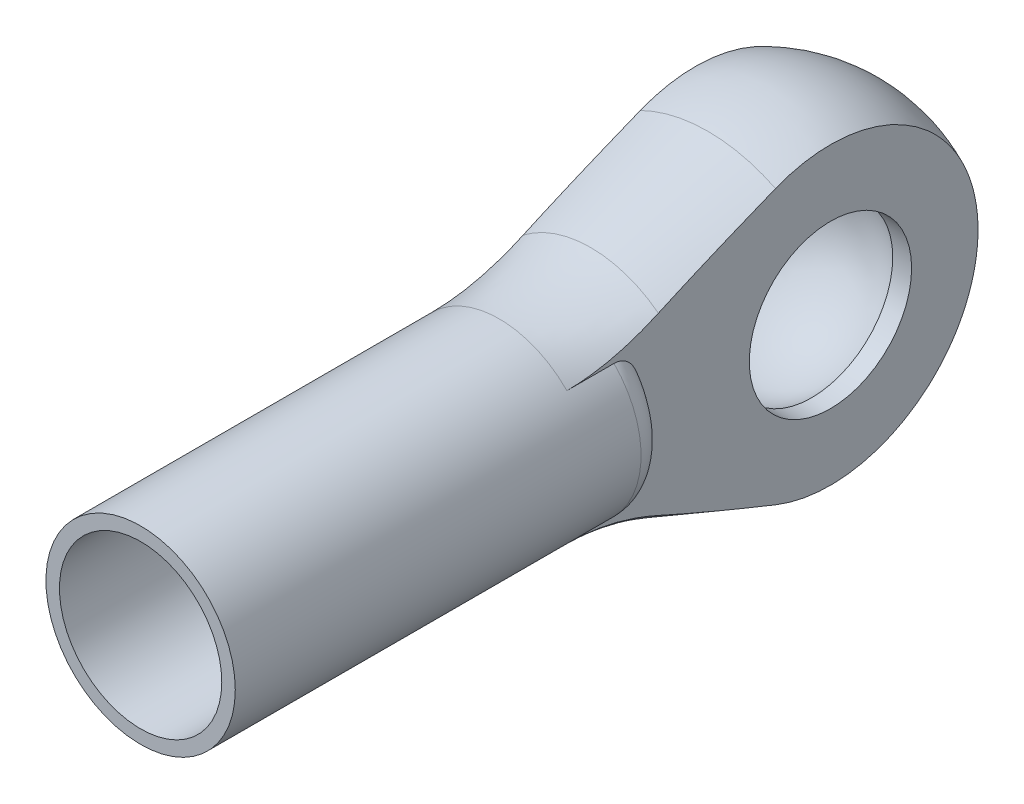
from build123d import *

# Parameters (mm, degrees)
SKETCH2_W           = 3.765548925
SKETCH2_H           = 14.748929387
SKETCH2_W_2         = 4.619974481
CUT_EXTRUDE1_DEPTH  = 17.5
CHAMFER1_SIZE       = 0.353571801
CHAMFER1_SIZE_2     = 0.5
SKETCH3_R           = 3
CUT_EXTRUDE2_DEPTH  = 35
SKETCH4_R           = 3.5
SKETCH4_R_2         = 3
BOSS_EXTRUDE1_DEPTH = 15
BOSS_EXTRUDE2_DEPTH = 1
BOSS_EXTRUDE3_START = -1
SKETCH4_2_R         = 3.5
SKETCH4_2_R_2       = 3
BOSS_EXTRUDE3_DEPTH = 1
BOSS_EXTRUDE4_START = -1
BOSS_EXTRUDE4_DEPTH = 1
FILLET1_R           = 1
FILLET2_R           = 10


# Some blends are built 0.0001 mm under size
with BuildPart() as part:
    # Sketch1 → Revolve1 (revolve)
    with BuildSketch(Plane(origin=(0, 0, 0), x_dir=(0, 0, -1), z_dir=(1, 0, 0))):
        with BuildLine():
            Line((0, 3.5), (0, 0))
            Line((0, 0), (4.5, 0))
            ThreePointArc((4.5, 0), (8, 3.5), (11.5, 0))
            Line((11.5, 0), (14, 0))
            ThreePointArc((14, 0), (11.451186904, 4.908086078), (5.97023035, 5.6462408))
            Line((5.97023035, 5.6462408), (0, 3.5))
        make_face()
    revolve(axis=Axis((0, 0, 0), (0, 0, -1)))

    # Sketch2 → Cut-Extrude1 (cut, symmetric)
    with BuildSketch(Plane(origin=(0, 0, 0), x_dir=(1, 0, 0), z_dir=(0, 1, 0))):
        with Locations((-4.382774463, 6.625535306)):
            Rectangle(SKETCH2_W, SKETCH2_H)
        with Locations((4.80998724, 6.625535306)):
            Rectangle(SKETCH2_W_2, SKETCH2_H)
    extrude(amount=CUT_EXTRUDE1_DEPTH, both=True, mode=Mode.SUBTRACT)

    # Chamfer1
    # the kernel refuses this chamfer: 0.5, 0.353571801 mm, written as the material it takes off along each edge
    with BuildSketch(Plane(origin=(-2.5, 0, -8), x_dir=(0, 0, 1), z_dir=(0, 1, 0))) as chamfer1_piece_1:
        with BuildLine():
            Line((2.807242504, 0.409691525), (2.449489743 + CHAMFER1_SIZE * 0.999999998636, 0))
            Line((2.449489743 + CHAMFER1_SIZE * 0.999999998636, 0), (2.449489743, 0))
            ThreePointArc((2.449489743, 0), (2.641353047, 0.203643303), (2.807242504, 0.409691525))
        make_face()
    revolve(axis=Axis((-2.5, 0, -8), (1, 0, 0)), mode=Mode.SUBTRACT)
    with BuildSketch(Plane(origin=(2.5, 0, -8), x_dir=(0, 0, -1), z_dir=(0, 1, 0))) as chamfer1_piece_2:
        with BuildLine():
            Line((2.449489743 + CHAMFER1_SIZE_2, 0), (2.689392867, 0.260096876))
            ThreePointArc((2.689392867, 0.260096876), (2.573005025, 0.127312675), (2.449489743, 0))
            Line((2.449489743, 0), (2.449489743 + CHAMFER1_SIZE_2, 0))
        make_face()
    revolve(axis=Axis((2.5, 0, -8), (-1, 0, 0)), mode=Mode.SUBTRACT)

    # Sketch3 → Cut-Extrude2 (cut)
    with BuildSketch(Plane(origin=(2.5, 0, 0), x_dir=(0, 0, -1), z_dir=(1, 0, 0))):
        with Locations((8, 0)):
            Circle(SKETCH3_R)
    extrude(amount=-CUT_EXTRUDE2_DEPTH, mode=Mode.SUBTRACT)

    # Sketch4 → Boss-Extrude1 (add)
    with BuildSketch(Plane.XY):
        with Locations(Location((0, 0, 0), (0, 0, 135.584691403))):
            Circle(SKETCH4_R)
        with Locations(Location((0, 0, 0), (0, 0, 213.557309762))):
            Circle(SKETCH4_R_2, mode=Mode.SUBTRACT)
    extrude(amount=BOSS_EXTRUDE1_DEPTH)

    # Sketch5 → Boss-Extrude2 (add)
    with BuildSketch(Plane.XY):
        with BuildLine():
            Line((2.5, 1.658312395), (2.5, -1.658312395))
            ThreePointArc((2.5, -1.658312395), (2.872281323, -0.866025404), (3, 0))
            ThreePointArc((3, 0), (2.872281323, 0.866025404), (2.5, 1.658312395))
        make_face()
        with BuildLine():
            ThreePointArc((-2.5, -1.658312395), (0, -3), (2.5, -1.658312395))
            Line((2.5, -1.658312395), (2.5, 1.658312395))
            ThreePointArc((2.5, 1.658312395), (0, 3), (-2.5, 1.658312395))
            Line((-2.5, 1.658312395), (-2.5, -1.658312395))
        make_face()
        with BuildLine():
            ThreePointArc((-2.5, 1.658312395), (-3, 0), (-2.5, -1.658312395))
            Line((-2.5, -1.658312395), (-2.5, 1.658312395))
        make_face()
    extrude(amount=BOSS_EXTRUDE2_DEPTH)

    # Sketch4<2> → Boss-Extrude3 (add)
    with BuildSketch(Plane.XY.offset(BOSS_EXTRUDE3_START)):
        with Locations(Location((0, 0, 0), (0, 0, 135.584691403))):
            Circle(SKETCH4_2_R)
        Circle(SKETCH4_2_R_2, mode=Mode.SUBTRACT)
    extrude(amount=BOSS_EXTRUDE3_DEPTH)

    # Sketch5<4> → Boss-Extrude4 (add)
    with BuildSketch(Plane.XY.offset(BOSS_EXTRUDE4_START)):
        with BuildLine():
            Line((2.5, 1.658312395), (2.5, -1.658312395))
            ThreePointArc((2.5, -1.658312395), (2.872281323, -0.866025404), (3, 0))
            ThreePointArc((3, 0), (2.872281323, 0.866025404), (2.5, 1.658312395))
        make_face()
        with BuildLine():
            ThreePointArc((-2.5, 1.658312395), (-3, 0), (-2.5, -1.658312395))
            Line((-2.5, -1.658312395), (-2.5, 1.658312395))
        make_face()
    extrude(amount=BOSS_EXTRUDE4_DEPTH)

    # Fillet1
    fillet1_edges = [part.edges().sort_by_distance(p)[0] for p in [
        (-3.5, 0, -1),
        (3.5, 0, -1),
    ]]
    fillet(fillet1_edges, radius=FILLET1_R - 0.0001)  # a hair under: the kernel refuses the full size

    # Fillet2
    # the kernel refuses this fillet: 10 mm, written as the material it adds along each edge
    with BuildSketch(Plane(origin=(0, 0, 0), x_dir=(-0.8914706902273792, -0.453078369010837, 0), z_dir=(0.453078369010837, -0.8914706902273792, 0))) as fillet2_piece_1_section:
        with BuildLine():
            CenterArc((3.5 + FILLET2_R, -FILLET2_R * 0.174285392608), FILLET2_R, 160.226973292, 19.773026708)
            Line((3.5 + FILLET2_R * 0.0589598667305, FILLET2_R * 0.164009549087), (3.5, 0))
            Line((3.5, 0), (3.5, -FILLET2_R * 0.174285392608))
        make_face()
    fillet2_piece_1 = revolve(axis=Axis((0, 0, 0), (0, 0, -1)), revolution_arc=233.882722234, mode=Mode.PRIVATE)
    fillet2_piece_1 = split(fillet2_piece_1, bisect_by=Plane(origin=(2.5, 0, 0), z_dir=(-1, 0, 0)), keep=Keep.TOP, mode=Mode.PRIVATE)
    fillet2_piece_1 = split(fillet2_piece_1, bisect_by=Plane(origin=(-2.5, 0, 0), z_dir=(1, 0, 0)), keep=Keep.TOP, mode=Mode.PRIVATE)
    add(fillet2_piece_1)
    with BuildSketch(Plane(origin=(0, 0, 0), x_dir=(0.8914706902273793, 0.4530783690108364, 0), z_dir=(-0.4530783690108364, 0.8914706902273793, 0))) as fillet2_piece_2_section:
        with BuildLine():
            CenterArc((3.5 + FILLET2_R, -FILLET2_R * 0.174285392608), FILLET2_R, 160.226973292, 19.773026708)
            Line((3.5 + FILLET2_R * 0.0589598667305, FILLET2_R * 0.164009549087), (3.5, 0))
            Line((3.5, 0), (3.5, -FILLET2_R * 0.174285392608))
        make_face()
    fillet2_piece_2 = revolve(axis=Axis((0, 0, 0), (0, 0, -1)), revolution_arc=233.882722234, mode=Mode.PRIVATE)
    fillet2_piece_2 = split(fillet2_piece_2, bisect_by=Plane(origin=(2.5, 0, 0), z_dir=(-1, 0, 0)), keep=Keep.TOP, mode=Mode.PRIVATE)
    fillet2_piece_2 = split(fillet2_piece_2, bisect_by=Plane(origin=(-2.5, 0, 0), z_dir=(1, 0, 0)), keep=Keep.TOP, mode=Mode.PRIVATE)
    add(fillet2_piece_2)


solid = part.part
